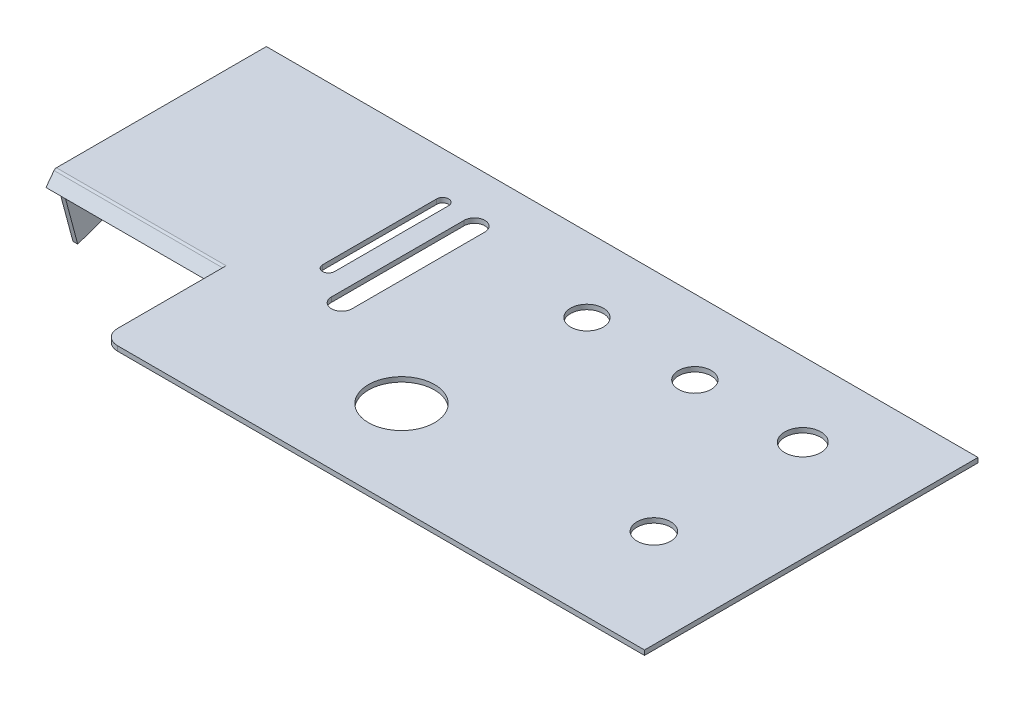
from build123d import *

# Parameters (mm, degrees)
SKETCH2_R           = 5.5
SKETCH2_R_2         = 6.05
SKETCH2_R_3         = 11.1
SKETCH2_R_4         = 5.65
BOSS_EXTRUDE1_DEPTH = 1.6
BOSS_EXTRUDE2_DEPTH = 57
FILLET1_R           = 1
BOSS_EXTRUDE3_DEPTH = 1.6


with BuildPart() as part:
    # Sketch2 → Boss-Extrude1 (new body)
    with BuildSketch(Plane(origin=(0, 0, 0), x_dir=(1, 0, 0), z_dir=(0, 1, 0))):
        with BuildLine():
            Line((-101.372215876, -12.515500752), (-44.372215876, -12.515500752))
            Line((-44.372215876, -12.515500752), (-44.372215876, -48.515500752))
            ThreePointArc((-44.372215876, -48.515500752), (-42.907749781, -52.051034657), (-39.372215876, -53.515500752))
            Line((-39.372215876, -53.515500752), (137.627784124, -53.515500752))
            Line((137.627784124, -53.515500752), (137.627784124, 58.484499248))
            Line((137.627784124, 58.484499248), (-101.372215876, 58.484499248))
            Line((-101.372215876, 58.484499248), (-101.372215876, -12.515500752))
        make_face()
        with Locations((31.285988016, 33.484499248)):
            Circle(SKETCH2_R, mode=Mode.SUBTRACT)
        with Locations((67.535988016, 33.484499248)):
            Circle(SKETCH2_R, mode=Mode.SUBTRACT)
        with Locations((103.785988016, 33.484499248)):
            Circle(SKETCH2_R_2, mode=Mode.SUBTRACT)
        with Locations((25.177784124, -22.665500752)):
            Circle(SKETCH2_R_3, mode=Mode.SUBTRACT)
        with Locations((104.727784124, -17.465500752)):
            Circle(SKETCH2_R_4, mode=Mode.SUBTRACT)
        with BuildLine():
            Line((-28.472215876, 4.484499248), (-28.472215876, 42.784499248))
            ThreePointArc((-28.472215876, 42.784499248), (-26.472215876, 44.784499248), (-24.472215876, 42.784499248))
            Line((-24.472215876, 42.784499248), (-24.472215876, 4.484499248))
            ThreePointArc((-24.472215876, 4.484499248), (-26.472215876, 2.484499248), (-28.472215876, 4.484499248))
        make_face(mode=Mode.SUBTRACT)
        with BuildLine():
            Line((-10.722215876, 41.184499248), (-10.722215876, -3.415500752))
            ThreePointArc((-10.722215876, -3.415500752), (-14.172215876, -6.865500752), (-17.622215876, -3.415500752))
            Line((-17.622215876, -3.415500752), (-17.622215876, 41.184499248))
            ThreePointArc((-17.622215876, 41.184499248), (-14.172215876, 44.634499248), (-10.722215876, 41.184499248))
        make_face(mode=Mode.SUBTRACT)
    extrude(amount=BOSS_EXTRUDE1_DEPTH)

    # Sketch3 → Boss-Extrude2 (add)
    with BuildSketch(Plane.ZY.offset(44.372215876)):
        Polygon((12.515500752, 1.6), (15.515500752, -2.4), (12.515500752, -2.4), align=None)
    extrude(amount=BOSS_EXTRUDE2_DEPTH)

    # Fillet1
    fillet1_edges = [part.edges().sort_by_distance(p)[0] for p in [
        (-72.872215876, 1.6, 12.515500752),
    ]]
    fillet(fillet1_edges, radius=FILLET1_R)

    # Sketch5 → Boss-Extrude3 (add)
    with BuildSketch(Plane.ZY.offset(101.372215876)):
        Polygon((-58.484499248, 0), (12.515500752, 0), (6.459135096, -22.602664335), align=None)
    extrude(amount=-BOSS_EXTRUDE3_DEPTH)


solid = part.part
